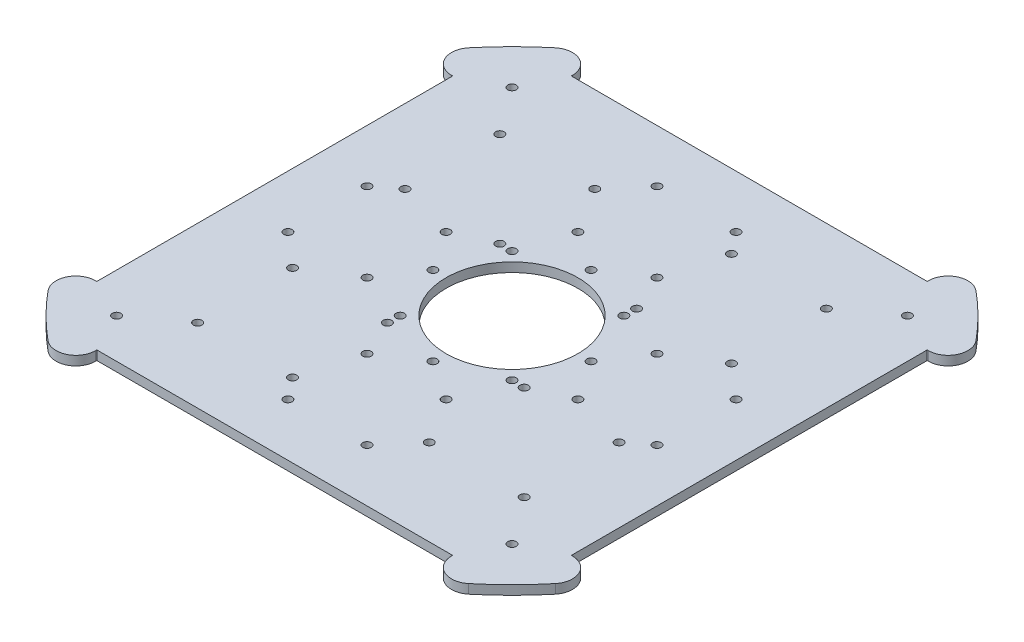
from build123d import *

# Parameters (mm, degrees)
BOSS_EXTRUDE1_DEPTH     = 3.5
FILLET1_R               = 7.5
CUT_EXTRUDE2_DEPTH      = 139.566799333
CUT_EXTRUDE2_DEPTH_BACK = 139.566799333
SKETCH3_R               = 1.6
CUT_EXTRUDE3_DEPTH      = 139.566799333
CUT_EXTRUDE3_DEPTH_BACK = 139.566799333
SKETCH4_R               = 25
SKETCH4_R_2             = 1.6
CUT_EXTRUDE4_DEPTH      = 139.566799333
CUT_EXTRUDE4_DEPTH_BACK = 139.566799333
SKETCH5_R               = 1.6
SKETCH7_R               = 1.6
CUT_EXTRUDE6_DEPTH      = 139.566799333
CIRPATTERN2_COUNT       = 4


with BuildPart() as part:
    # Sketch1 → Boss-Extrude1 (new body)
    with BuildSketch(Plane(origin=(0, 0, 0), x_dir=(1, 0, 0), z_dir=(0, 1, 0))):
        with BuildLine():
            Line((90, 67.5), (105.208127063, 67.5))
            ThreePointArc((105.208127063, 67.5), (88.388347648, 88.388347648), (67.5, 105.208127063))
            Line((67.5, 105.208127063), (67.5, 90))
            Line((67.5, 90), (-67.5, 90))
            Line((-67.5, 90), (-67.5, 105.208127063))
            ThreePointArc((-67.5, 105.208127063), (-88.388347648, 88.388347648), (-105.208127063, 67.5))
            Line((-105.208127063, 67.5), (-90, 67.5))
            Line((-90, 67.5), (-90, -67.5))
            Line((-90, -67.5), (-105.208127063, -67.5))
            ThreePointArc((-105.208127063, -67.5), (-88.388347648, -88.388347648), (-67.5, -105.208127063))
            Line((-67.5, -105.208127063), (-67.5, -90))
            Line((-67.5, -90), (67.5, -90))
            Line((67.5, -90), (67.5, -105.208127063))
            ThreePointArc((67.5, -105.208127063), (88.388347648, -88.388347648), (105.208127063, -67.5))
            Line((105.208127063, -67.5), (90, -67.5))
            Line((90, -67.5), (90, 67.5))
        make_face()
    extrude(amount=BOSS_EXTRUDE1_DEPTH)

    # Fillet1
    fillet1_edges = [part.edges().sort_by_distance(p)[0] for p in [
        (-105.208127063, 1.75, 67.5),
        (-105.208127063, 1.75, -67.5),
        (-67.5, 1.75, -105.208127063),
        (67.5, 1.75, -105.208127063),
        (105.208127063, 1.75, -67.5),
        (105.208127063, 1.75, 67.5),
        (67.5, 1.75, 105.208127063),
        (-67.5, 1.75, 105.208127063),
    ]]
    fillet(fillet1_edges, radius=FILLET1_R)

    # Sketch3 → Cut-Extrude2 (cut, two sides: drawn at the far end of the back side and taken through both)
    with BuildSketch(Plane(origin=(0, 3.5, 0), x_dir=(1, 0, 0), z_dir=(0, 1, 0)).offset(-CUT_EXTRUDE2_DEPTH_BACK)):
        with Locations((-15, -70)):
            Circle(SKETCH3_R)
        with Locations((-15, -40)):
            Circle(SKETCH3_R)
        with Locations((15, -40)):
            Circle(SKETCH3_R)
        with Locations((15, -70)):
            Circle(SKETCH3_R)
        with Locations((-40, 15)):
            Circle(SKETCH3_R)
        with Locations((-40, -15)):
            Circle(SKETCH3_R)
        with Locations((-70, -15)):
            Circle(SKETCH3_R)
        with Locations((-70, 15)):
            Circle(SKETCH3_R)
        with Locations((15, 40)):
            Circle(SKETCH3_R)
        with Locations((-15, 40)):
            Circle(SKETCH3_R)
        with Locations((-15, 70)):
            Circle(SKETCH3_R)
        with Locations((15, 70)):
            Circle(SKETCH3_R)
        with Locations((40, -15)):
            Circle(SKETCH3_R)
        with Locations((40, 15)):
            Circle(SKETCH3_R)
        with Locations((70, 15)):
            Circle(SKETCH3_R)
        with Locations((70, -15)):
            Circle(SKETCH3_R)
    extrude(amount=CUT_EXTRUDE2_DEPTH + CUT_EXTRUDE2_DEPTH_BACK, mode=Mode.SUBTRACT)

    # Sketch4 → Cut-Extrude3 (cut, two sides: drawn at the far end of the back side and taken through both)
    with BuildSketch(Plane(origin=(0, 3.5, 0), x_dir=(1, 0, 0), z_dir=(0, 1, 0)).offset(-CUT_EXTRUDE3_DEPTH_BACK)):
        Circle(SKETCH4_R)
        with Locations((0, 30)):
            Circle(SKETCH4_R_2)
        with Locations((21.213203436, 21.213203436)):
            Circle(SKETCH4_R_2)
        with Locations((30, 0)):
            Circle(SKETCH4_R_2)
        with Locations((21.213203436, -21.213203436)):
            Circle(SKETCH4_R_2)
        with Locations((0, -30)):
            Circle(SKETCH4_R_2)
        with Locations((-21.213203436, -21.213203436)):
            Circle(SKETCH4_R_2)
        with Locations((-30, 0)):
            Circle(SKETCH4_R_2)
        with Locations((-21.213203436, 21.213203436)):
            Circle(SKETCH4_R_2)
    extrude(amount=CUT_EXTRUDE3_DEPTH + CUT_EXTRUDE3_DEPTH_BACK, mode=Mode.SUBTRACT)

    # Sketch5 → Cut-Extrude4 (cut, two sides: drawn at the far end of the back side and taken through both)
    with BuildSketch(Plane(origin=(0, 3.5, 0), x_dir=(1, 0, 0), z_dir=(0, 1, 0)).offset(-CUT_EXTRUDE4_DEPTH_BACK)):
        with Locations((75, -75)):
            Circle(SKETCH5_R)
        with Locations((-75, -75)):
            Circle(SKETCH5_R)
        with Locations((75, 75)):
            Circle(SKETCH5_R)
        with Locations((-75, 75)):
            Circle(SKETCH5_R)
    extrude(amount=CUT_EXTRUDE4_DEPTH + CUT_EXTRUDE4_DEPTH_BACK, mode=Mode.SUBTRACT)

    # Sketch7 → Cut-Extrude6 (cut, symmetric)
    with BuildSketch(Plane(origin=(0, 3.5, 0), x_dir=(1, 0, 0), z_dir=(0, 1, 0))):
        with Locations((25.932993074, -21.325563638)):
            Circle(SKETCH7_R)
        with Locations((61.932993074, -21.325563638)):
            Circle(SKETCH7_R)
        with Locations((61.932993074, -57.325563638)):
            Circle(SKETCH7_R)
        with Locations((25.932993074, -57.325563638)):
            Circle(SKETCH7_R)
    cut_extrude6 = extrude(amount=CUT_EXTRUDE6_DEPTH, both=True, mode=Mode.SUBTRACT)

    # CirPattern2: Cut-Extrude6 ×4 about axis
    cirpattern2_axis = Axis((0, 3.5, 0), (0, 1, 0))
    for i in range(1, CIRPATTERN2_COUNT):
        add(cut_extrude6.rotate(cirpattern2_axis, i * 360 / CIRPATTERN2_COUNT), mode=Mode.SUBTRACT)


solid = part.part
